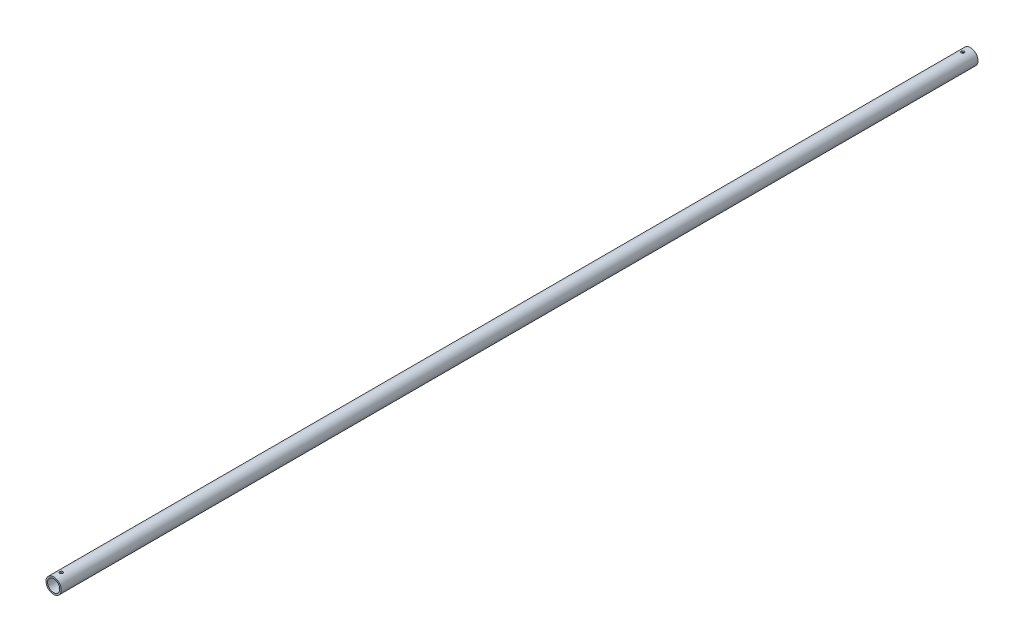
from build123d import *

# Parameters (mm, degrees)
EXTRUDE_1_DEPTH          = 300
EXTRUDE_1_DEPTH_BACK     = 300
SKETCH_1_R               = 5
SKETCH_1_R_2             = 4
CUT_EXTRUDE_2_DEPTH      = 301.083321762
CUT_EXTRUDE_2_DEPTH_BACK = 301.083321762
SKETCH_3_R               = 1


with BuildPart() as part:
    # 草图1 → 凸台-拉伸1 (new, two sides: drawn at the far end of the back side and taken through both)
    with BuildSketch(Plane.XY.offset(-EXTRUDE_1_DEPTH_BACK)):
        Circle(SKETCH_1_R)
        Circle(SKETCH_1_R_2, mode=Mode.SUBTRACT)
    extrude(amount=EXTRUDE_1_DEPTH + EXTRUDE_1_DEPTH_BACK)

    # 草图3 → 切除-拉伸2 (cut, two sides: drawn at the far end of the back side and taken through both)
    with BuildSketch(Plane(origin=(0, 0, 0), x_dir=(1, 0, 0), z_dir=(0, 1, 0)).offset(-CUT_EXTRUDE_2_DEPTH_BACK)):
        with Locations((0, 295)):
            Circle(SKETCH_3_R)
        with Locations((0, -295)):
            Circle(SKETCH_3_R)
    extrude(amount=CUT_EXTRUDE_2_DEPTH + CUT_EXTRUDE_2_DEPTH_BACK, mode=Mode.SUBTRACT)


solid = part.part
